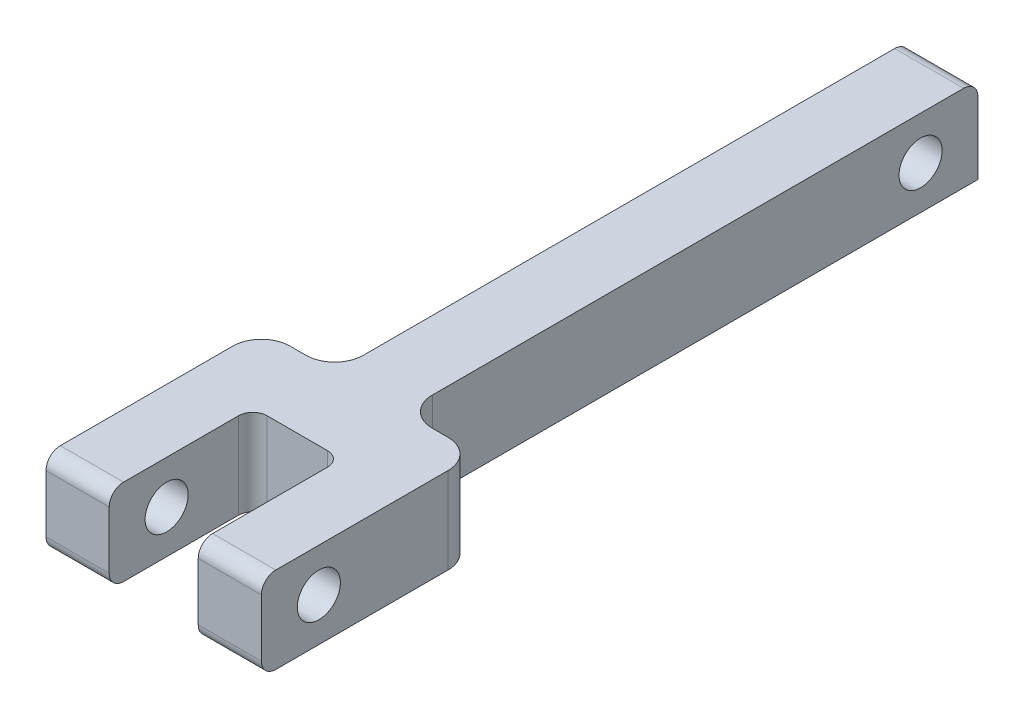
from build123d import *
from build123d.topology import SkipClean

# Parameters (mm, degrees)
SALIENTE_EXTRUIR1_DEPTH    = 2.4
CORTAR_EXTRUIR1_DEPTH      = 28.767066824
CORTAR_EXTRUIR1_DEPTH_BACK = 28.767066824
CROQUIS2_R                 = 1.5
CROQUIS3_R                 = 1.5
SALIENTE_EXTRUIR2_DEPTH    = 7.5
CORTAR_EXTRUIR2_DEPTH      = 3.1
REDONDEO1_R                = 2
REDONDEO2_R                = 1


with BuildPart() as part:
    # Croquis1 → Saliente-Extruir1 (new, symmetric)
    with BuildSketch(Plane(origin=(0, 0, 0), x_dir=(0, 0, -1), z_dir=(1, 0, 0))):
        with BuildLine():
            Line((-26.5, 3), (26.5, 3))
            ThreePointArc((26.5, 3), (27.207106781, 2.707106781), (27.5, 2))
            Line((27.5, 2), (27.5, -2))
            Line((27.5, -2), (27.5, -3))
            Line((27.5, -3), (26.5, -3))
            Line((26.5, -3), (-26.5, -3))
            ThreePointArc((-26.5, -3), (-27.207106781, -2.707106781), (-27.5, -2))
            Line((-27.5, -2), (-27.5, 2))
            ThreePointArc((-27.5, 2), (-27.207106781, 2.707106781), (-26.5, 3))
        make_face()
    extrude(amount=SALIENTE_EXTRUIR1_DEPTH, both=True)

    # Croquis2 → Cortar-Extruir1 (cut, two sides: drawn at the far end of the back side and taken through both)
    with BuildSketch(Plane(origin=(0, 0, 0), x_dir=(0, 0, -1), z_dir=(1, 0, 0)).offset(-CORTAR_EXTRUIR1_DEPTH_BACK)):
        with Locations((-23.5, 0)):
            Circle(CROQUIS2_R)
        with Locations((23.5, 0)):
            Circle(CROQUIS2_R)
    extrude(amount=CORTAR_EXTRUIR1_DEPTH + CORTAR_EXTRUIR1_DEPTH_BACK, mode=Mode.SUBTRACT)

    # Croquis3 → Saliente-Extruir2 (add, symmetric)
    with SkipClean():  # the faces are left unmerged after this step: merging them gives an invalid solid
        with BuildSketch(Plane(origin=(0, 0, 0), x_dir=(0, 0, -1), z_dir=(1, 0, 0))):
            with BuildLine():
                Line((-27.5, 2), (-27.5, -2))
                ThreePointArc((-27.5, -2), (-27.207106781, -2.707106781), (-26.5, -3))
                Line((-26.5, -3), (-12.5, -3))
                Line((-12.5, -3), (-12.5, 3))
                Line((-12.5, 3), (-26.5, 3))
                ThreePointArc((-26.5, 3), (-27.207106781, 2.707106781), (-27.5, 2))
            make_face()
            with Locations((-23.5, 0)):
                Circle(CROQUIS3_R, mode=Mode.SUBTRACT)
        extrude(amount=SALIENTE_EXTRUIR2_DEPTH, both=True)
    add(part.part.scale(1), mode=Mode.REPLACE)  # the faces are merged on a copy

    # Croquis4 → Cortar-Extruir2 (cut, symmetric)
    with BuildSketch(Plane(origin=(0, 0, 0), x_dir=(0, 0, -1), z_dir=(1, 0, 0))):
        with BuildLine():
            Line((-26.5, 3), (-17.5, 3))
            Line((-17.5, 3), (-17.5, -3))
            Line((-17.5, -3), (-26.5, -3))
            ThreePointArc((-26.5, -3), (-27.207106781, -2.707106781), (-27.5, -2))
            Line((-27.5, -2), (-27.5, 2))
            ThreePointArc((-27.5, 2), (-27.207106781, 2.707106781), (-26.5, 3))
        make_face()
    extrude(amount=CORTAR_EXTRUIR2_DEPTH, both=True, mode=Mode.SUBTRACT)

    # Redondeo1
    redondeo1_edges = [part.edges().sort_by_distance(p)[0] for p in [
        (2.4, 0, 12.5),
        (-2.4, 0, 12.5),
        (7.5, 0, 12.5),
        (-7.5, 0, 12.5),
    ]]
    fillet(redondeo1_edges, radius=REDONDEO1_R)

    # Redondeo2
    redondeo2_edges = [part.edges().sort_by_distance(p)[0] for p in [
        (3.1, 0, 17.5),
        (-3.1, 0, 17.5),
    ]]
    fillet(redondeo2_edges, radius=REDONDEO2_R)


solid = part.part
